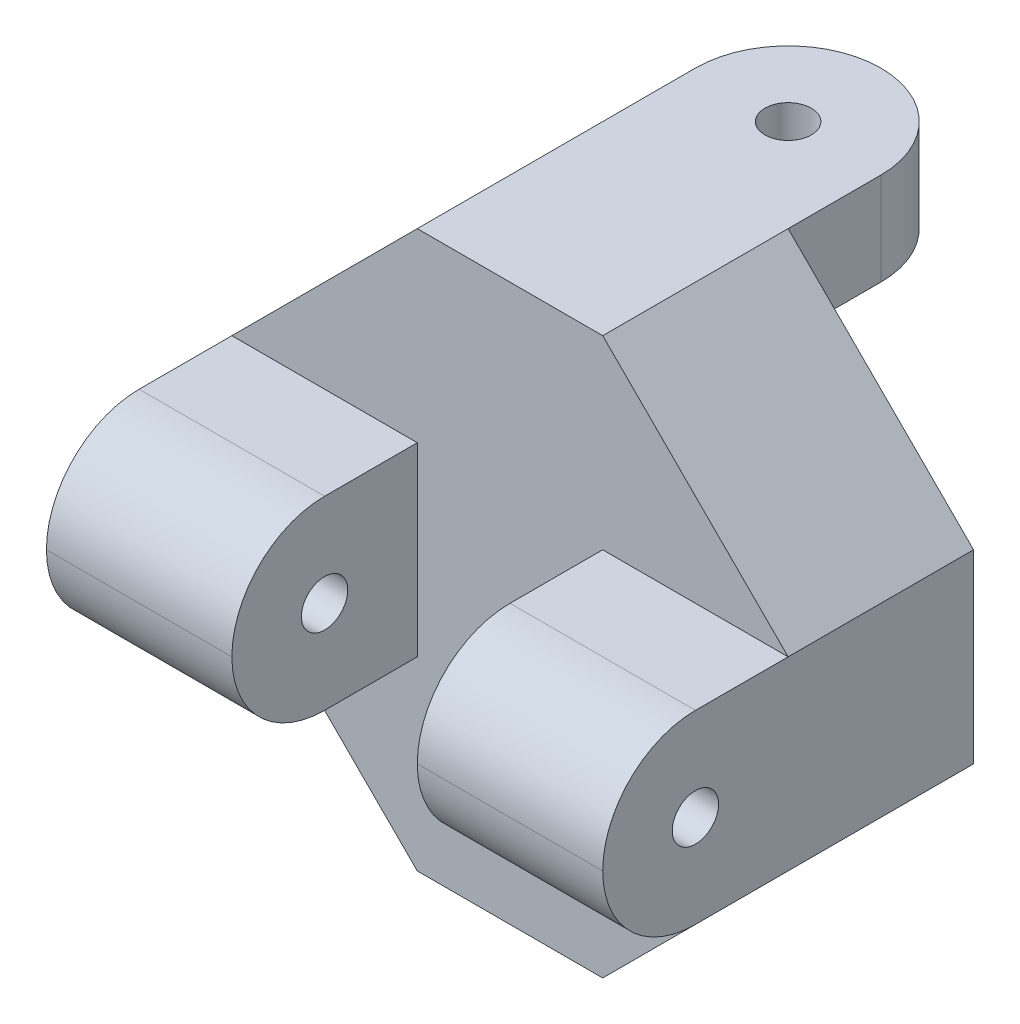
from build123d import *

# Parameters (mm, degrees)
SKETCH1_W             = 25.4
SKETCH1_H             = 25.4
BOSS_EXTRUDE1_DEPTH   = 12.7
BOSS_EXTRUDE1_2_DEPTH = 12.7
BOSS_EXTRUDE2_DEPTH   = 25.4
SKETCH3_R             = 3.175
CUT_EXTRUDE1_DEPTH    = 100.190170884
FILLET1_R             = 12.7
BOSS_EXTRUDE3_DEPTH   = 76.2
SKETCH5_W             = 25.4
SKETCH5_H             = 50.8
CUT_EXTRUDE2_DEPTH    = 96.882897328


with BuildPart() as part:
    # Sketch1 → Boss-Extrude1 (new, symmetric)
    with BuildSketch(Plane.XY):
        with Locations((-12.7, 12.7)):
            Rectangle(SKETCH1_W, SKETCH1_H)
    extrude(amount=BOSS_EXTRUDE1_DEPTH, both=True)



with BuildPart() as body_2:
    # Sketch1 → Boss-Extrude1 2 (new, symmetric)
    with BuildSketch(Plane.XY):
        with Locations((38.1, 12.7)):
            Rectangle(SKETCH1_W, SKETCH1_H)
    extrude(amount=BOSS_EXTRUDE1_2_DEPTH, both=True)


with BuildPart() as part_1:
    add(part.part)

    add(body_2.part)  # Boss-Extrude2 merges body 2
    # Sketch2 → Boss-Extrude2 (add)
    with BuildSketch(Plane(origin=(0, 0, -12.7), x_dir=(-1, 0, 0), z_dir=(0, 0, -1))):
        Polygon((-50.8, 25.4), (-25.4, 50.8), (0, 50.8), (25.4, 25.4), (25.4, 0), (0, -25.4), (-25.4, -25.4), (-50.8, 0), align=None)
    extrude(amount=BOSS_EXTRUDE2_DEPTH)

    # Sketch3 → Cut-Extrude1 (cut, through all)
    with BuildSketch(Plane(origin=(50.8, 0, 0), x_dir=(0, 0, -1), z_dir=(1, 0, 0))):
        with Locations(Location((0, 12.7, 0), (0, 0, 90))):
            Circle(SKETCH3_R)
    extrude(amount=-CUT_EXTRUDE1_DEPTH, mode=Mode.SUBTRACT)

    # Fillet1
    fillet1_edges = [part_1.edges().sort_by_distance(p)[0] for p in [
        (38.1, 0, 12.7),
        (-12.7, 0, 12.7),
        (-12.7, 25.4, 12.7),
        (38.1, 25.4, 12.7),
    ]]
    fillet(fillet1_edges, radius=FILLET1_R - 0.0001)  # a hair under: the kernel refuses the full size

    # Sketch4 → Boss-Extrude3 (add)
    with BuildSketch(Plane(origin=(0, 50.8, 0), x_dir=(1, 0, 0), z_dir=(0, 1, 0))):
        with BuildLine():
            ThreePointArc((0, 50.8), (3.719743896, 41.819743862), (12.700000049, 38.1))
            ThreePointArc((12.700000049, 38.1), (21.680256138, 41.819743896), (25.4, 50.8))
            Line((25.4, 50.8), (15.875, 50.8))
            ThreePointArc((15.875, 50.8), (12.7, 47.625), (9.525, 50.8))
            Line((9.525, 50.8), (0, 50.8))
        make_face()
        with BuildLine():
            ThreePointArc((25.4, 50.8), (12.7, 63.5), (0, 50.8))
            Line((0, 50.8), (9.525, 50.8))
            ThreePointArc((9.525, 50.8), (12.7, 53.975), (15.875, 50.8))
            Line((15.875, 50.8), (25.4, 50.8))
        make_face()
        with BuildLine():
            Line((0, 50.8), (0, 38.1))
            Line((0, 38.1), (12.700000049, 38.1))
            ThreePointArc((12.700000049, 38.1), (3.719743896, 41.819743862), (0, 50.8))
        make_face()
        with BuildLine():
            ThreePointArc((25.4, 50.8), (21.680256138, 41.819743896), (12.700000049, 38.1))
            Line((12.700000049, 38.1), (25.4, 38.1))
            Line((25.4, 38.1), (25.4, 50.8))
        make_face()
    extrude(amount=-BOSS_EXTRUDE3_DEPTH)

    # Sketch5 → Cut-Extrude2 (cut, through all)
    with BuildSketch(Plane(origin=(25.4, 0, 0), x_dir=(0, 0, -1), z_dir=(1, 0, 0))):
        with Locations((50.8, 12.7)):
            Rectangle(SKETCH5_W, SKETCH5_H)
    extrude(amount=-CUT_EXTRUDE2_DEPTH, mode=Mode.SUBTRACT)


solid = part_1.part
